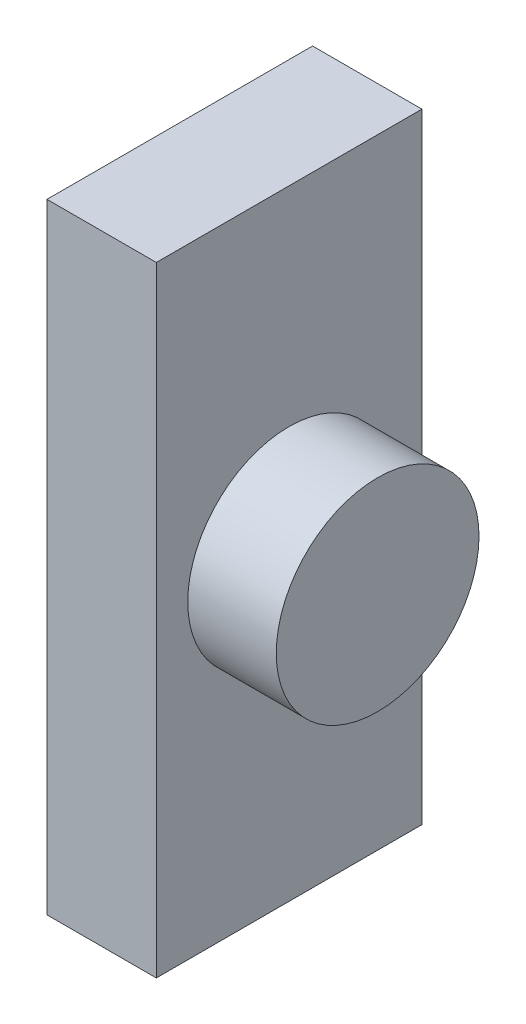
from build123d import *

# Parameters (mm, degrees)
SKETCH1_W           = 15
SKETCH1_H           = 35
SKETCH1_W_2         = 3.175
SKETCH1_H_2         = 13
BOSS_EXTRUDE1_DEPTH = 4.175
SKETCH2_W           = 15
SKETCH2_H           = 35
BOSS_EXTRUDE2_DEPTH = 2
SKETCH3_R           = 5.725
BOSS_EXTRUDE3_DEPTH = 5


with BuildPart() as part:
    # Sketch1 → Boss-Extrude1 (new body)
    with BuildSketch(Plane(origin=(0, 0, 0), x_dir=(0, 0, -1), z_dir=(1, 0, 0))):
        with Locations((7.5, 17.5)):
            Rectangle(SKETCH1_W, SKETCH1_H)
        with Locations((7.5, 17.5)):
            Rectangle(SKETCH1_W_2, SKETCH1_H_2, mode=Mode.SUBTRACT)
    extrude(amount=BOSS_EXTRUDE1_DEPTH)

    # Sketch2 → Boss-Extrude2 (add)
    with BuildSketch(Plane(origin=(4.175, 0, 0), x_dir=(0, 0, -1), z_dir=(1, 0, 0))):
        with Locations((7.5, 17.5)):
            Rectangle(SKETCH2_W, SKETCH2_H)
    extrude(amount=BOSS_EXTRUDE2_DEPTH)

    # Sketch3 → Boss-Extrude3 (add)
    with BuildSketch(Plane(origin=(6.175, 0, 0), x_dir=(0, 0, -1), z_dir=(1, 0, 0))):
        with Locations((7.5, 17.5)):
            Circle(SKETCH3_R)
    extrude(amount=BOSS_EXTRUDE3_DEPTH)


solid = part.part
